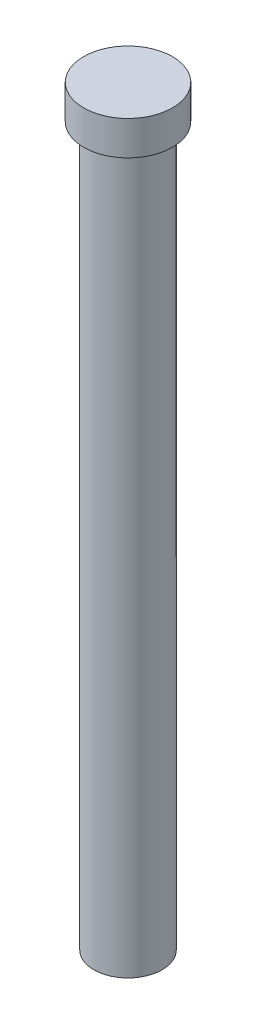
from build123d import *


with BuildPart() as part:
    # Sketch1 → Revolve1 (revolve)
    with BuildSketch(Plane.XY):
        Polygon((0, 0), (6.5, 0), (6.5, -5), (5, -5), (5, -110), (0, -110), align=None)
    revolve(axis=Axis((0, -115, 0), (0, 1, 0)))


solid = part.part
